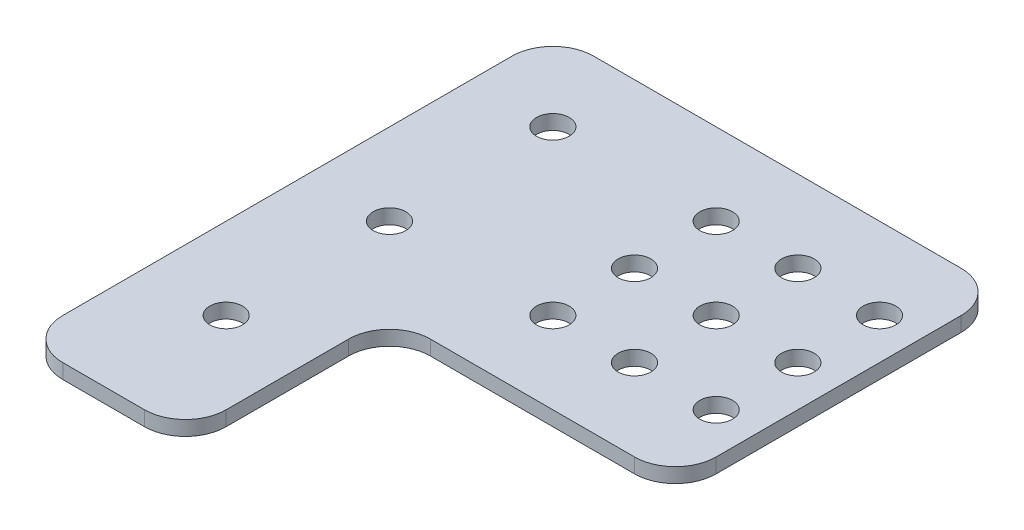
from build123d import *

# Parameters (mm, degrees)
SKETCH1_R           = 2.54
BOSS_EXTRUDE1_DEPTH = 2.286
SKETCH2_W           = 25.4
SKETCH2_H           = 31.75
CUT_EXTRUDE1_DEPTH  = 2.54
FILLET1_R           = 6.35


with BuildPart() as part:
    # Sketch1 → Boss-Extrude1 (new body)
    with BuildSketch(Plane(origin=(0, 0, 0), x_dir=(1, 0, 0), z_dir=(0, 1, 0))):
        Polygon((25.4, 114.3), (0, 114.3), (0, 0), (25.4, 0), (25.4, 31.75), (69.85, 31.75), (69.85, 82.55), (25.4, 82.55), align=None)
        with Locations((12.7, 95.25)):
            Circle(SKETCH1_R, mode=Mode.SUBTRACT)
        with Locations((12.7, 69.85)):
            Circle(SKETCH1_R, mode=Mode.SUBTRACT)
        with Locations((12.7, 44.45)):
            Circle(SKETCH1_R, mode=Mode.SUBTRACT)
        with Locations((12.7, 19.05)):
            Circle(SKETCH1_R, mode=Mode.SUBTRACT)
        with Locations((38.1, 69.85)):
            Circle(SKETCH1_R, mode=Mode.SUBTRACT)
        with Locations((50.8, 69.85)):
            Circle(SKETCH1_R, mode=Mode.SUBTRACT)
        with Locations((63.5, 69.85)):
            Circle(SKETCH1_R, mode=Mode.SUBTRACT)
        with Locations((50.8, 57.15)):
            Circle(SKETCH1_R, mode=Mode.SUBTRACT)
        with Locations((63.5, 57.15)):
            Circle(SKETCH1_R, mode=Mode.SUBTRACT)
        with Locations((50.8, 44.45)):
            Circle(SKETCH1_R, mode=Mode.SUBTRACT)
        with Locations((63.5, 44.45)):
            Circle(SKETCH1_R, mode=Mode.SUBTRACT)
        with Locations((38.1, 57.15)):
            Circle(SKETCH1_R, mode=Mode.SUBTRACT)
        with Locations((38.1, 44.45)):
            Circle(SKETCH1_R, mode=Mode.SUBTRACT)
    extrude(amount=BOSS_EXTRUDE1_DEPTH)

    # Sketch2 → Cut-Extrude1 (cut)
    with BuildSketch(Plane(origin=(0, 2.286, 0), x_dir=(1, 0, 0), z_dir=(0, 1, 0))):
        with Locations((12.7, 98.425)):
            Rectangle(SKETCH2_W, SKETCH2_H)
    extrude(amount=-CUT_EXTRUDE1_DEPTH, mode=Mode.SUBTRACT)

    # Fillet1
    fillet1_edges = [part.edges().sort_by_distance(p)[0] for p in [
        (69.85, 1.143, -82.55),
        (69.85, 1.143, -31.75),
        (25.4, 1.143, -31.75),
        (25.4, 1.143, 0),
        (0, 1.143, 0),
        (0, 1.143, -82.55),
    ]]
    fillet(fillet1_edges, radius=FILLET1_R)


solid = part.part
